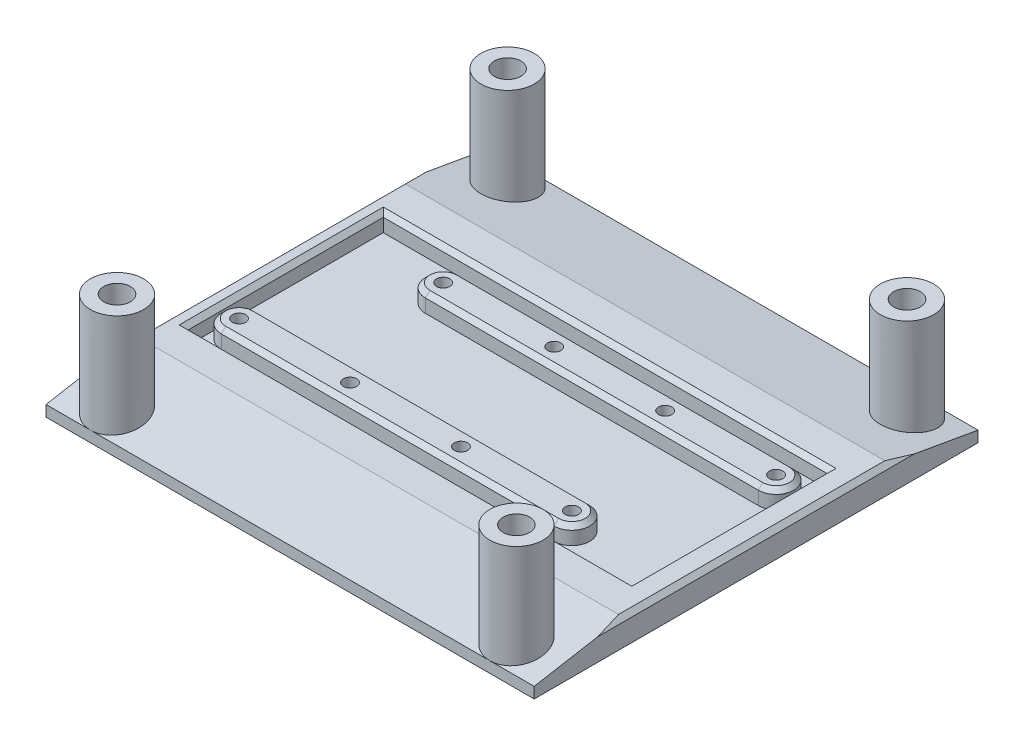
from build123d import *

# Parameters (mm, degrees)
SKETCH_1_W       = 110
SKETCH_1_H       = 100
SKETCH_1_R       = 3
EXTRUDE_1_DEPTH  = 2
SKETCH_2_W       = 110
SKETCH_2_H       = 100
SKETCH_2_R       = 3
SKETCH_2_W_2     = 100
SKETCH_2_H_2     = 44
SKETCH_2_R_2     = 1.5
EXTRUDE_2_DEPTH  = 4
CHAMFER_1_SIZE   = 1
SKETCH_3_R       = 6
SKETCH_3_R_2     = 3
EXTRUDE_3_DEPTH  = 20
CHAMFER_2_SIZE   = 1
CHAMFER_3_SIZE   = 20
CHAMFER_3_SIZE_2 = 3.526539614


with BuildPart() as part:
    # Эскиз1 → Бобышка-Вытянуть1 (new body)
    with BuildSketch(Plane(origin=(0, 0, 0), x_dir=(1, 0, 0), z_dir=(0, 1, 0))):
        Rectangle(SKETCH_1_W, SKETCH_1_H)
        with Locations(Location((-45, 44, 0), (0, 0, 270))):
            Circle(SKETCH_1_R, mode=Mode.SUBTRACT)
        with Locations(Location((-45, -44, 0), (0, 0, 270))):
            Circle(SKETCH_1_R, mode=Mode.SUBTRACT)
        with Locations(Location((45, -44, 0), (0, 0, 270))):
            Circle(SKETCH_1_R, mode=Mode.SUBTRACT)
        with Locations(Location((45, 44, 0), (0, 0, 270))):
            Circle(SKETCH_1_R, mode=Mode.SUBTRACT)
    extrude(amount=EXTRUDE_1_DEPTH)

    # Эскиз2 → Бобышка-Вытянуть2 (add)
    # profile 1 of 3: a face of its own
    with BuildSketch(Plane(origin=(0, 2, 0), x_dir=(1, 0, 0), z_dir=(0, 1, 0))):
        Rectangle(SKETCH_2_W, SKETCH_2_H)
        with Locations(Location((-45, -44, 0), (0, 0, 270))):
            Circle(SKETCH_2_R, mode=Mode.SUBTRACT)
        with Locations(Location((45, -44, 0), (0, 0, 270))):
            Circle(SKETCH_2_R, mode=Mode.SUBTRACT)
        with Locations(Location((45, 44, 0), (0, 0, 270))):
            Circle(SKETCH_2_R, mode=Mode.SUBTRACT)
        with Locations(Location((-45, 44, 0), (0, 0, 270))):
            Circle(SKETCH_2_R, mode=Mode.SUBTRACT)
        with Locations((-1, 0)):
            Rectangle(SKETCH_2_W_2, SKETCH_2_H_2, mode=Mode.SUBTRACT)
    # profile 2 of 3: a face of its own
    with BuildSketch(Plane(origin=(0, 2, 0), x_dir=(1, 0, 0), z_dir=(0, 1, 0))):
        with BuildLine():
            ThreePointArc((44.5, 19), (48.5, 15), (44.5, 11))
            Line((44.5, 11), (-30.5, 11))
            ThreePointArc((-30.5, 11), (-34.5, 15), (-30.5, 19))
            Line((-30.5, 19), (44.5, 19))
        make_face()
        with Locations(Location((44.5, 15, 0), (0, 0, 270))):
            Circle(SKETCH_2_R_2, mode=Mode.SUBTRACT)
        with Locations(Location((19.5, 15, 0), (0, 0, 270))):
            Circle(SKETCH_2_R_2, mode=Mode.SUBTRACT)
        with Locations(Location((-5.5, 15, 0), (0, 0, 270))):
            Circle(SKETCH_2_R_2, mode=Mode.SUBTRACT)
        with Locations(Location((-30.5, 15, 0), (0, 0, 270))):
            Circle(SKETCH_2_R_2, mode=Mode.SUBTRACT)
    # profile 3 of 3: a face of its own
    with BuildSketch(Plane(origin=(0, 2, 0), x_dir=(1, 0, 0), z_dir=(0, 1, 0))):
        with BuildLine():
            ThreePointArc((28.5, -11), (32.5, -15), (28.5, -19))
            Line((28.5, -19), (-46.5, -19))
            ThreePointArc((-46.5, -19), (-50.5, -15), (-46.5, -11))
            Line((-46.5, -11), (28.5, -11))
        make_face()
        with Locations(Location((-46.5, -15, 0), (0, 0, 270))):
            Circle(SKETCH_2_R_2, mode=Mode.SUBTRACT)
        with Locations(Location((-21.5, -15, 0), (0, 0, 270))):
            Circle(SKETCH_2_R_2, mode=Mode.SUBTRACT)
        with Locations(Location((3.5, -15, 0), (0, 0, 270))):
            Circle(SKETCH_2_R_2, mode=Mode.SUBTRACT)
        with Locations(Location((28.5, -15, 0), (0, 0, 270))):
            Circle(SKETCH_2_R_2, mode=Mode.SUBTRACT)
    extrude(amount=EXTRUDE_2_DEPTH)

    # Фаска1
    chamfer_1_edges = [part.edges().sort_by_distance(p)[0] for p in [
        (-1, 6, 22),
        (-51, 6, 0),
        (49, 6, 0),
        (-1, 6, -22),
        (48.5, 6, -15),
        (7, 6, -19),
        (-34.5, 6, -15),
        (7, 6, -11),
        (32.5, 6, 15),
        (-9, 6, 11),
        (-50.5, 6, 15),
        (-9, 6, 19),
    ]]
    chamfer(chamfer_1_edges, length=CHAMFER_1_SIZE)

    # Эскиз3 → Бобышка-Вытянуть3 (add)
    # profile 1 of 4: a face of its own
    with BuildSketch(Plane(origin=(0, 6, 0), x_dir=(1, 0, 0), z_dir=(0, 1, 0))):
        with Locations(Location((-45, -44, 0), (0, 0, 270))):
            Circle(SKETCH_3_R)
        with Locations(Location((-45, -44, 0), (0, 0, 270))):
            Circle(SKETCH_3_R_2, mode=Mode.SUBTRACT)
    # profile 2 of 4: a face of its own
    with BuildSketch(Plane(origin=(0, 6, 0), x_dir=(1, 0, 0), z_dir=(0, 1, 0))):
        with Locations(Location((45, -44, 0), (0, 0, 270))):
            Circle(SKETCH_3_R)
        with Locations(Location((45, -44, 0), (0, 0, 270))):
            Circle(SKETCH_3_R_2, mode=Mode.SUBTRACT)
    # profile 3 of 4: a face of its own
    with BuildSketch(Plane(origin=(0, 6, 0), x_dir=(1, 0, 0), z_dir=(0, 1, 0))):
        with Locations(Location((45, 44, 0), (0, 0, 90))):
            Circle(SKETCH_3_R)
        with Locations(Location((45, 44, 0), (0, 0, 270))):
            Circle(SKETCH_3_R_2, mode=Mode.SUBTRACT)
    # profile 4 of 4: a face of its own
    with BuildSketch(Plane(origin=(0, 6, 0), x_dir=(1, 0, 0), z_dir=(0, 1, 0))):
        with Locations(Location((-45, 44, 0), (0, 0, 90))):
            Circle(SKETCH_3_R)
        with Locations(Location((-45, 44, 0), (0, 0, 270))):
            Circle(SKETCH_3_R_2, mode=Mode.SUBTRACT)
    extrude(amount=EXTRUDE_3_DEPTH)

    # Фаска2
    chamfer_2_edges = [part.edges().sort_by_distance(p)[0] for p in [
        (55, 6, 0),
        (-55, 6, 0),
    ]]
    chamfer(chamfer_2_edges, length=CHAMFER_2_SIZE)

    # Фаска3
    # the kernel refuses this chamfer: 20, 3.526539614 mm, written as the material it takes off along each edge
    with BuildSketch(Plane(origin=(-105.970775928, 6, -50), x_dir=(0, 0.006682531656101757, 0.9999776716360547), z_dir=(1, 0, 0))) as chamfer_3_piece_1_section:
        Polygon((CHAMFER_3_SIZE * 0.999977671636, CHAMFER_3_SIZE * 0.0066825316561), (-CHAMFER_3_SIZE_2 * 0.00668253165642, CHAMFER_3_SIZE_2 * 0.999977671684), (0, 0), align=None)
    chamfer_3_piece_1 = extrude(amount=60.970775928, mode=Mode.PRIVATE)
    chamfer_3_piece_1 = chamfer_3_piece_1 - Plane(origin=(-45, 4.865335076, -44), x_dir=(0, 0, -1), z_dir=(0, -1, 0)) * Cylinder(6, 202, mode=Mode.PRIVATE)
    add(chamfer_3_piece_1, mode=Mode.SUBTRACT)
    with BuildSketch(Plane(origin=(105.970775928, 6, 50), x_dir=(0, 0.006682531656101757, -0.9999776716360547), z_dir=(-1, 0, 0))) as chamfer_3_piece_2_section:
        Polygon((CHAMFER_3_SIZE * 0.999977671636, CHAMFER_3_SIZE * 0.0066825316561), (-CHAMFER_3_SIZE_2 * 0.00668253165642, CHAMFER_3_SIZE_2 * 0.999977671684), (0, 0), align=None)
    chamfer_3_piece_2 = extrude(amount=60.970775928, mode=Mode.PRIVATE)
    chamfer_3_piece_2 = chamfer_3_piece_2 - Plane(origin=(45, 4.865335076, 44), x_dir=(0, 0, 1), z_dir=(0, -1, 0)) * Cylinder(6, 202, mode=Mode.PRIVATE)
    add(chamfer_3_piece_2, mode=Mode.SUBTRACT)
    with BuildSketch(Plane(origin=(45, 6, 50), x_dir=(0, 0.006682531656101757, -0.9999776716360547), z_dir=(-1, 0, 0))) as chamfer_3_piece_3_section:
        Polygon((CHAMFER_3_SIZE * 0.999977671636, CHAMFER_3_SIZE * 0.0066825316561), (-CHAMFER_3_SIZE_2 * 0.00668253165642, CHAMFER_3_SIZE_2 * 0.999977671684), (0, 0), align=None)
    chamfer_3_piece_3 = extrude(amount=90, mode=Mode.PRIVATE)
    chamfer_3_piece_3 = chamfer_3_piece_3 - Plane(origin=(45, 4.835622005, 44), x_dir=(0, 0, 1), z_dir=(0, -1, 0)) * Cylinder(6, 260, mode=Mode.PRIVATE)
    chamfer_3_piece_3 = chamfer_3_piece_3 - Plane(origin=(-45, 4.835622005, 44), x_dir=(0, 0, 1), z_dir=(0, -1, 0)) * Cylinder(6, 260, mode=Mode.PRIVATE)
    add(chamfer_3_piece_3, mode=Mode.SUBTRACT)
    with BuildSketch(Plane(origin=(-45, 6, 50), x_dir=(0, 0.006682531656101757, -0.9999776716360547), z_dir=(-1, 0, 0))) as chamfer_3_piece_4_section:
        Polygon((CHAMFER_3_SIZE * 0.999977671636, CHAMFER_3_SIZE * 0.0066825316561), (-CHAMFER_3_SIZE_2 * 0.00668253165642, CHAMFER_3_SIZE_2 * 0.999977671684), (0, 0), align=None)
    chamfer_3_piece_4 = extrude(amount=60.970775928, mode=Mode.PRIVATE)
    chamfer_3_piece_4 = chamfer_3_piece_4 - Plane(origin=(-45, 4.865335076, 44), x_dir=(0, 0, 1), z_dir=(0, -1, 0)) * Cylinder(6, 202, mode=Mode.PRIVATE)
    add(chamfer_3_piece_4, mode=Mode.SUBTRACT)
    with BuildSketch(Plane(origin=(-45, 6, -50), x_dir=(0, 0.006682531656101757, 0.9999776716360547), z_dir=(1, 0, 0))) as chamfer_3_piece_5_section:
        Polygon((CHAMFER_3_SIZE * 0.999977671636, CHAMFER_3_SIZE * 0.0066825316561), (-CHAMFER_3_SIZE_2 * 0.00668253165642, CHAMFER_3_SIZE_2 * 0.999977671684), (0, 0), align=None)
    chamfer_3_piece_5 = extrude(amount=90, mode=Mode.PRIVATE)
    chamfer_3_piece_5 = chamfer_3_piece_5 - Plane(origin=(45, 4.835622005, -44), x_dir=(0, 0, -1), z_dir=(0, -1, 0)) * Cylinder(6, 260, mode=Mode.PRIVATE)
    chamfer_3_piece_5 = chamfer_3_piece_5 - Plane(origin=(-45, 4.835622005, -44), x_dir=(0, 0, -1), z_dir=(0, -1, 0)) * Cylinder(6, 260, mode=Mode.PRIVATE)
    add(chamfer_3_piece_5, mode=Mode.SUBTRACT)
    with BuildSketch(Plane(origin=(45, 6, -50), x_dir=(0, 0.006682531656101757, 0.9999776716360547), z_dir=(1, 0, 0))) as chamfer_3_piece_6_section:
        Polygon((CHAMFER_3_SIZE * 0.999977671636, CHAMFER_3_SIZE * 0.0066825316561), (-CHAMFER_3_SIZE_2 * 0.00668253165642, CHAMFER_3_SIZE_2 * 0.999977671684), (0, 0), align=None)
    chamfer_3_piece_6 = extrude(amount=60.970775928, mode=Mode.PRIVATE)
    chamfer_3_piece_6 = chamfer_3_piece_6 - Plane(origin=(45, 4.865335076, -44), x_dir=(0, 0, -1), z_dir=(0, -1, 0)) * Cylinder(6, 202, mode=Mode.PRIVATE)
    add(chamfer_3_piece_6, mode=Mode.SUBTRACT)


solid = part.part
